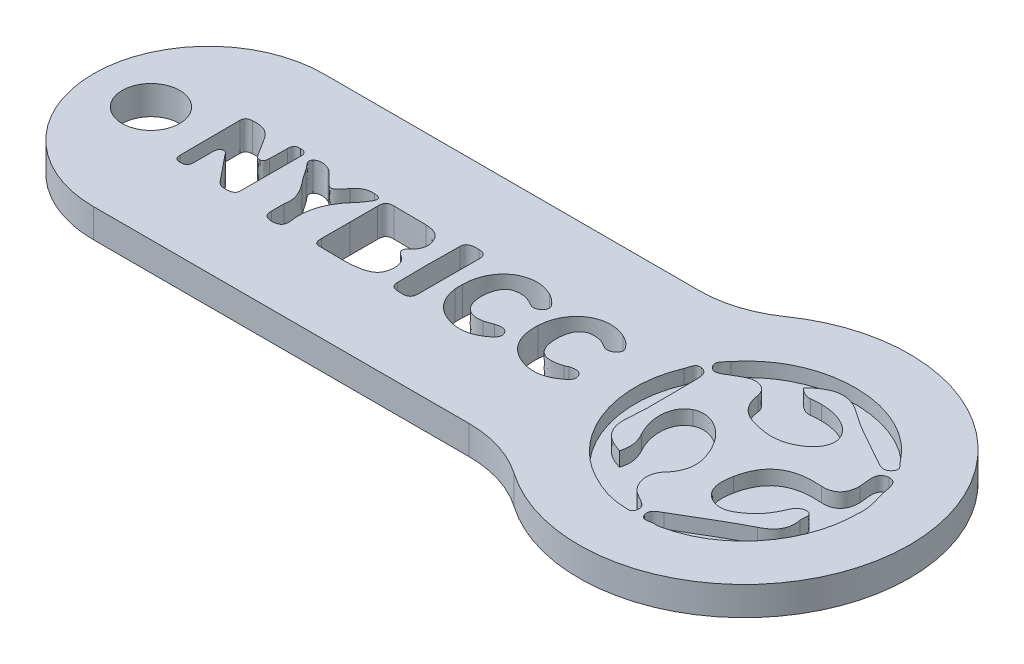
from build123d import *

# Parameters (mm, degrees)
ESQUISSE1_R             = 2
BOSS_EXTRU_1_DEPTH      = 2
ENL_V_MAT_EXTRU_1_DEPTH = 41.002266801
ENL_V_MAT_EXTRU_2_DEPTH = 1
CONG_1_R                = 8


with BuildPart() as part:
    # Esquisse1 → Boss.-Extru.1 (new body)
    with BuildSketch(Plane(origin=(0, 0, 0), x_dir=(1, 0, 0), z_dir=(0, 1, 0))):
        with BuildLine():
            Line((-18.5, 8), (18.5, 8))
            ThreePointArc((18.5, 8), (38.261355821, 0), (18.5, -8))
            Line((18.5, -8), (-18.5, -8))
            Line((-18.5, -8), (-18.5, 8))
        make_face()
        with Locations(Location((-14.5, 0, 0), (0, 0, 270))):
            Circle(ESQUISSE1_R, mode=Mode.SUBTRACT)
    extrude(amount=BOSS_EXTRU_1_DEPTH)

    # Esquisse4 → Enlèv. mat.-Extru.1 (cut, through all)
    with BuildSketch(Plane(origin=(0, 2, 0), x_dir=(1, 0, 0), z_dir=(0, 1, 0))):
        with BuildLine():
            add(Edge.make_bspline(
                [(-6.3332062, -1.619049103), (-6.335767284, -1.888353596), (-6.25457224, -2.225895783), (-6.622652099, -2.312538556)],
                knots=[1, 1, 1, 1, 2, 2, 2, 2], degree=3))
            add(Edge.make_bspline(
                [(-6.622652099, -2.312538556), (-6.978013353, -2.396142756), (-7.346071508, -2.405866193), (-7.617351073, -2.065979963)],
                knots=[2, 2, 2, 2, 3, 3, 3, 3], degree=3))
            add(Edge.make_bspline(
                [(-7.617351073, -2.065979963), (-8.070966795, -1.497592951), (-8.529769798, -0.933373127), (-8.990678099, -0.370976448)],
                knots=[3, 3, 3, 3, 4, 4, 4, 4], degree=3))
            add(Edge.make_bspline(
                [(-8.990678099, -0.370976448), (-9.10683845, -0.22911844), (-9.206699022, -0.003395784), (-9.43962744, -0.104363264)],
                knots=[4, 4, 4, 4, 5, 5, 5, 5], degree=3))
            add(Edge.make_bspline(
                [(-9.43962744, -0.104363264), (-9.635875926, -0.189530159), (-9.657037425, -0.403098518), (-9.657406395, -0.60234217)],
                knots=[5, 5, 5, 5, 6, 6, 6, 6], degree=3))
            add(Edge.make_bspline(
                [(-9.657406395, -0.60234217), (-9.658144334, -1.030520686), (-9.663939329, -1.458612385), (-9.660705418, -1.886704084)],
                knots=[6, 6, 6, 6, 7, 7, 7, 7], degree=3))
            add(Edge.make_bspline(
                [(-9.660705418, -1.886704084), (-9.665849103, -2.219614951), (-9.847620698, -2.329439876), (-10.15591047, -2.322324401)],
                knots=[7, 7, 7, 7, 8, 8, 8, 8], degree=3))
            add(Edge.make_bspline(
                [(-10.15591047, -2.322324401), (-10.450137814, -2.315450477), (-10.589503308, -2.175379299), (-10.582869285, -1.886704084)],
                knots=[8, 8, 8, 8, 9, 9, 9, 9], degree=3))
            add(Edge.make_bspline(
                [(-10.582869285, -1.886704084), (-10.59099202, -0.495407593), (-10.597877528, 0.895873393), (-10.604633139, 2.287220144)],
                knots=[9, 9, 9, 9, 10, 10, 10, 10], degree=3))
            add(Edge.make_bspline(
                [(-10.604633139, 2.287220144), (-10.590666703, 2.573025978), (-10.443715605, 2.692856466), (-10.15310637, 2.706122551)],
                knots=[10, 10, 10, 10, 11, 11, 11, 11], degree=3))
            add(Edge.make_bspline(
                [(-10.15310637, 2.706122551), (-9.500572557, 2.768109465), (-8.976114647, 2.5926101), (-8.626201122, 2.002388762)],
                knots=[11, 11, 11, 11, 12, 12, 12, 12], degree=3))
            add(Edge.make_bspline(
                [(-8.626201122, 2.002388762), (-8.39796079, 1.617444817), (-8.151814574, 1.243135881), (-7.910095995, 0.86630927)],
                knots=[12, 12, 12, 12, 13, 13, 13, 13], degree=3))
            add(Edge.make_bspline(
                [(-7.910095995, 0.86630927), (-7.816790062, 0.720761565), (-7.709875658, 0.563493645), (-7.510458373, 0.602083538)],
                knots=[13, 13, 13, 13, 14, 14, 14, 14], degree=3))
            add(Edge.make_bspline(
                [(-7.510458373, 0.602083538), (-7.299190648, 0.642887248), (-7.277964037, 0.851420256), (-7.267828221, 1.010728362)],
                knots=[14, 14, 14, 14, 15, 15, 15, 15], degree=3))
            add(Edge.make_bspline(
                [(-7.267828221, 1.010728362), (-7.242152269, 1.415943938), (-7.241457738, 1.823373332), (-7.247730223, 2.229717522)],
                knots=[15, 15, 15, 15, 16, 16, 16, 16], degree=3))
            add(Edge.make_bspline(
                [(-7.247730223, 2.229717522), (-7.252678759, 2.549201896), (-7.124689672, 2.704863713), (-6.793702123, 2.701434465)],
                knots=[16, 16, 16, 16, 17, 17, 17, 17], degree=3))
            add(Edge.make_bspline(
                [(-6.793702123, 2.701434465), (-6.473392992, 2.698135441), (-6.323634691, 2.555930168), (-6.326043847, 2.234405607)],
                knots=[17, 17, 17, 17, 18, 18, 18, 18], degree=3))
            add(Edge.make_bspline(
                [(-6.326043847, 2.234405607), (-6.331296239, 1.527937102), (-6.329190941, 0.821468596), (-6.329842064, 0.115021795)],
                knots=[18, 18, 18, 18, 19, 19, 19, 19], degree=3))
            add(Edge.make_bspline(
                [(-6.329842064, 0.115021795), (-6.330384667, -0.463001838), (-6.327845287, -1.041025471), (-6.3332062, -1.619049103)],
                knots=[0, 0, 0, 0, 1, 1, 1, 1], degree=3))
        make_face()
        with BuildLine():
            add(Edge.make_bspline(
                [(-2.655267904, 2.01232924), (-2.346917733, 2.402134904), (-2.0133691, 2.586749992), (-1.5106587, 2.554931779)],
                knots=[6, 6, 6, 6, 7, 7, 7, 7], degree=3))
            add(Edge.make_bspline(
                [(-1.5106587, 2.554931779), (-1.007383993, 2.523070158), (-0.957616488, 2.325258977), (-1.202286825, 1.951557756)],
                knots=[7, 7, 7, 7, 8, 8, 8, 8], degree=3))
            add(Edge.make_bspline(
                [(-1.202286825, 1.951557756), (-1.330861923, 1.755135637), (-1.457939438, 1.553070451), (-1.615815072, 1.381217375)],
                knots=[8, 8, 8, 8, 9, 9, 9, 9], degree=3))
            add(Edge.make_bspline(
                [(-1.615815072, 1.381217375), (-2.498282137, 0.420507024), (-2.974817391, -0.669277619), (-2.774249789, -2.003819416)],
                knots=[9, 9, 9, 9, 10, 10, 10, 10], degree=3))
            add(Edge.make_bspline(
                [(-2.774249789, -2.003819416), (-2.700151986, -2.496676154), (-2.951919564, -2.704514631), (-3.448617928, -2.686630451)],
                knots=[10, 10, 10, 10, 11, 11, 11, 11], degree=3))
            add(Edge.make_bspline(
                [(-3.448617928, -2.686630451), (-3.854679964, -2.672132111), (-4.035149569, -2.48348006), (-4.037450203, -2.094108478)],
                knots=[11, 11, 11, 11, 12, 12, 12, 12], degree=3))
            add(Edge.make_bspline(
                [(-4.037450203, -2.094108478), (-4.038947787, -1.836958283), (-4.037124642, -1.579808088), (-4.036647152, -1.193909162)],
                knots=[12, 12, 12, 12, 13, 13, 13, 13], degree=3))
            add(Edge.make_bspline(
                [(-4.036647152, -1.193909162), (-3.889146078, -0.537490315), (-4.200773568, 0.095119133), (-4.679349007, 0.684602532)],
                knots=[0, 0, 0, 0, 1, 1, 1, 1], degree=3))
            add(Edge.make_bspline(
                [(-4.679349007, 0.684602532), (-4.935023323, 0.999355412), (-5.164023299, 1.337678948), (-5.383929256, 1.678997649)],
                knots=[1, 1, 1, 1, 2, 2, 2, 2], degree=3))
            add(Edge.make_bspline(
                [(-5.383929256, 1.678997649), (-5.535337068, 1.914053068), (-5.92592408, 2.169423527), (-5.662761849, 2.43629716)],
                knots=[2, 2, 2, 2, 3, 3, 3, 3], degree=3))
            add(Edge.make_bspline(
                [(-5.662761849, 2.43629716), (-5.411102791, 2.691624211), (-4.964909871, 2.616441203), (-4.634877303, 2.451793889)],
                knots=[3, 3, 3, 3, 4, 4, 4, 4], degree=3))
            add(Edge.make_bspline(
                [(-4.634877303, 2.451793889), (-4.414059774, 2.341623869), (-4.235435018, 2.13287382), (-4.060521663, 1.946999895)],
                knots=[4, 4, 4, 4, 5, 5, 5, 5], degree=3))
            add(Edge.make_bspline(
                [(-4.060521663, 1.946999895), (-3.340531502, 1.182017131), (-3.325751009, 1.164740666), (-2.655267904, 2.01232924)],
                knots=[5, 5, 5, 5, 6, 6, 6, 6], degree=3))
        make_face()
        with BuildLine():
            add(Edge.make_bspline(
                [(-0.244399098, -2.531923615), (-0.591512794, -2.54364383), (-0.649397633, -2.288143146), (-0.64779153, -2.003819416)],
                knots=[9, 9, 9, 9, 10, 10, 10, 10], degree=3))
            add(Edge.make_bspline(
                [(-0.64779153, -2.003819416), (-0.644145241, -1.340194807), (-0.645273854, -0.67674383), (-0.644492506, -0.013119221)],
                knots=[10, 10, 10, 10, 11, 11, 11, 11], degree=3))
            add(Edge.make_bspline(
                [(-0.644492506, -0.013119221), (-0.643689454, 0.628953215), (-0.629798829, 1.271394621), (-0.646879957, 1.91305468)],
                knots=[0, 0, 0, 0, 1, 1, 1, 1], degree=3))
            add(Edge.make_bspline(
                [(-0.646879957, 1.91305468), (-0.657753712, 2.319181828), (-0.512184303, 2.497936809), (-0.08745674, 2.48534843)],
                knots=[1, 1, 1, 1, 2, 2, 2, 2], degree=3))
            add(Edge.make_bspline(
                [(-0.08745674, 2.48534843), (0.661052611, 2.463253654), (1.411667259, 2.500237443), (2.159503782, 2.468332414)],
                knots=[2, 2, 2, 2, 3, 3, 3, 3], degree=3))
            add(Edge.make_bspline(
                [(2.159503782, 2.468332414), (2.661714988, 2.446845354), (3.143285593, 2.308069328), (3.366664207, 1.778359026)],
                knots=[3, 3, 3, 3, 4, 4, 4, 4], degree=3))
            add(Edge.make_bspline(
                [(3.366664207, 1.778359026), (3.581751853, 1.268139006), (3.484083396, 0.814219426), (3.06135261, 0.446638762)],
                knots=[4, 4, 4, 4, 5, 5, 5, 5], degree=3))
            add(Edge.make_bspline(
                [(3.06135261, 0.446638762), (2.742128684, 0.169021599), (2.809064134, -0.048366682), (3.140442356, -0.254295198)],
                knots=[5, 5, 5, 5, 6, 6, 6, 6], degree=3))
            add(Edge.make_bspline(
                [(3.140442356, -0.254295198), (3.659126975, -0.576557697), (3.719377561, -1.066983576), (3.595512253, -1.604203498)],
                knots=[6, 6, 6, 6, 7, 7, 7, 7], degree=3))
            add(Edge.make_bspline(
                [(3.595512253, -1.604203498), (3.479503831, -2.107304572), (3.097555051, -2.317226642), (2.633912034, -2.426094416)],
                knots=[7, 7, 7, 7, 8, 8, 8, 8], degree=3))
            add(Edge.make_bspline(
                [(2.633912034, -2.426094416), (1.681427537, -2.650080744), (0.715095823, -2.499888361), (-0.244399098, -2.531923615)],
                knots=[8, 8, 8, 8, 9, 9, 9, 9], degree=3))
        make_face()
        with BuildLine():
            add(Edge.make_bspline(
                [(5.47751384, 2.82232631), (5.878735861, 2.832700871), (6.06562988, 2.645915373), (6.061831662, 2.244346086)],
                knots=[5, 5, 5, 5, 6, 6, 6, 6], degree=3))
            add(Edge.make_bspline(
                [(6.061831662, 2.244346086), (6.055059982, 1.540134807), (6.058445822, 0.835836711), (6.057816403, 0.131603728)],
                knots=[6, 6, 6, 6, 7, 7, 7, 7], degree=3))
            add(Edge.make_bspline(
                [(6.057816403, 0.131603728), (6.057273801, -0.551294123), (6.05499487, -1.234278791), (6.056058371, -1.917176642)],
                knots=[0, 0, 0, 0, 1, 1, 1, 1], degree=3))
            add(Edge.make_bspline(
                [(6.056058371, -1.917176642), (6.05668779, -2.29022674), (5.938053171, -2.526020099), (5.502712302, -2.520377033)],
                knots=[1, 1, 1, 1, 2, 2, 2, 2], degree=3))
            add(Edge.make_bspline(
                [(5.502712302, -2.520377033), (5.098690451, -2.515081232), (4.652953318, -2.527235529), (4.640755613, -2.003819416)],
                knots=[2, 2, 2, 2, 3, 3, 3, 3], degree=3))
            add(Edge.make_bspline(
                [(4.640755613, -2.003819416), (4.607005735, -0.554072248), (4.605725193, 0.897563176), (4.643989524, 2.347180119)],
                knots=[3, 3, 3, 3, 4, 4, 4, 4], degree=3))
            add(Edge.make_bspline(
                [(4.643989524, 2.347180119), (4.656925168, 2.83682465), (5.108609226, 2.812733098), (5.47751384, 2.82232631)],
                knots=[4, 4, 4, 4, 5, 5, 5, 5], degree=3))
        make_face()
        with BuildLine():
            add(Edge.make_bspline(
                [(11.059969843, -2.108520002), (10.27202414, -2.707292756), (9.398390644, -2.76250799), (8.511213788, -2.400657209)],
                knots=[11, 11, 11, 11, 12, 12, 12, 12], degree=3))
            add(Edge.make_bspline(
                [(8.511213788, -2.400657209), (7.622192085, -2.038198713), (7.168098872, -1.314063068), (7.034032636, -0.381481233)],
                knots=[12, 12, 12, 12, 13, 13, 13, 13], degree=3))
            add(Edge.make_bspline(
                [(7.034032636, -0.381481233), (7.009854267, -0.213751936), (7.030994062, -0.039598225), (7.031211103, 0.131603728)],
                knots=[13, 13, 13, 13, 14, 14, 14, 14], degree=3))
            add(Edge.make_bspline(
                [(7.031211103, 0.131603728), (7.016951509, 2.218084123), (8.859781659, 3.476618156), (10.627016425, 2.589137443)],
                knots=[0, 0, 0, 0, 1, 1, 1, 1], degree=3))
            add(Edge.make_bspline(
                [(10.627016425, 2.589137443), (10.851870917, 2.476276115), (11.064397479, 2.315318498), (11.240374335, 2.135391496)],
                knots=[1, 1, 1, 1, 2, 2, 2, 2], degree=3))
            add(Edge.make_bspline(
                [(11.240374335, 2.135391496), (11.417306171, 1.954509514), (11.594845721, 1.71181425), (11.361570038, 1.46082802)],
                knots=[2, 2, 2, 2, 3, 3, 3, 3], degree=3))
            add(Edge.make_bspline(
                [(11.361570038, 1.46082802), (11.166493573, 1.250992766), (10.911774237, 1.117946623), (10.617119354, 1.292230559)],
                knots=[3, 3, 3, 3, 4, 4, 4, 4], degree=3))
            add(Edge.make_bspline(
                [(10.617119354, 1.292230559), (10.240075702, 1.51517509), (9.848446894, 1.666148821), (9.400734687, 1.588534953)],
                knots=[4, 4, 4, 4, 5, 5, 5, 5], degree=3))
            add(Edge.make_bspline(
                [(9.400734687, 1.588534953), (9.275892695, 1.566917668), (9.142282245, 1.555544719), (9.031417695, 1.501197649)],
                knots=[5, 5, 5, 5, 6, 6, 6, 6], degree=3))
            add(Edge.make_bspline(
                [(9.031417695, 1.501197649), (8.47518498, 1.22868095), (8.231382807, 0.184561736), (8.518766816, -0.653303401)],
                knots=[6, 6, 6, 6, 7, 7, 7, 7], degree=3))
            add(Edge.make_bspline(
                [(8.518766816, -0.653303401), (8.710110175, -1.210838361), (9.240905683, -1.47805926), (9.923543085, -1.340021174)],
                knots=[7, 7, 7, 7, 8, 8, 8, 8], degree=3))
            add(Edge.make_bspline(
                [(9.923543085, -1.340021174), (10.130339765, -1.298175666), (10.325242597, -1.199899494), (10.528827069, -1.138173029)],
                knots=[8, 8, 8, 8, 9, 9, 9, 9], degree=3))
            add(Edge.make_bspline(
                [(10.528827069, -1.138173029), (10.849440057, -1.041025471), (11.205126874, -0.985549787), (11.398814276, -1.311719025)],
                knots=[9, 9, 9, 9, 10, 10, 10, 10], degree=3))
            add(Edge.make_bspline(
                [(11.398814276, -1.311719025), (11.611427655, -1.669923518), (11.317033221, -1.913269904), (11.059969843, -2.108520002)],
                knots=[10, 10, 10, 10, 11, 11, 11, 11], degree=3))
        make_face()
        with BuildLine():
            add(Edge.make_bspline(
                [(15.6467656, 1.340891155), (15.484766186, 1.438776653), (15.31460603, 1.544866301), (15.134027905, 1.586668401)],
                knots=[10, 10, 10, 10, 11, 11, 11, 11], degree=3))
            add(Edge.make_bspline(
                [(15.134027905, 1.586668401), (14.124700366, 1.820421574), (13.573242554, 1.312545598), (13.56126189, 0.156867302)],
                knots=[11, 11, 11, 11, 12, 12, 12, 12], degree=3))
            add(Edge.make_bspline(
                [(13.56126189, 0.156867302), (13.547544897, -1.149459162), (14.215076245, -1.63363426), (15.450647338, -1.21231424)],
                knots=[0, 0, 0, 0, 1, 1, 1, 1], degree=3))
            add(Edge.make_bspline(
                [(15.450647338, -1.21231424), (15.531126147, -1.184880256), (15.605440991, -1.139475275), (15.686180248, -1.113256721)],
                knots=[1, 1, 1, 1, 2, 2, 2, 2], degree=3))
            add(Edge.make_bspline(
                [(15.686180248, -1.113256721), (16.012089037, -1.007253889), (16.361438256, -0.98476844), (16.542190014, -1.311719025)],
                knots=[2, 2, 2, 2, 3, 3, 3, 3], degree=3))
            add(Edge.make_bspline(
                [(16.542190014, -1.311719025), (16.74351726, -1.67591385), (16.435145385, -1.911620392), (16.178342455, -2.098188849)],
                knots=[3, 3, 3, 3, 4, 4, 4, 4], degree=3))
            add(Edge.make_bspline(
                [(16.178342455, -2.098188849), (15.318165502, -2.723006525), (14.388188159, -2.767282892), (13.462985718, -2.290747638)],
                knots=[4, 4, 4, 4, 5, 5, 5, 5], degree=3))
            add(Edge.make_bspline(
                [(13.462985718, -2.290747638), (12.430738648, -1.759083967), (12.067151538, -0.799328596), (12.119849097, 0.282577459)],
                knots=[5, 5, 5, 5, 6, 6, 6, 6], degree=3))
            add(Edge.make_bspline(
                [(12.119849097, 0.282577459), (12.217517554, 2.284672307), (13.977459741, 3.415673039), (15.694254174, 2.638839836)],
                knots=[6, 6, 6, 6, 7, 7, 7, 7], degree=3))
            add(Edge.make_bspline(
                [(15.694254174, 2.638839836), (15.931176147, 2.531621574), (16.145265405, 2.395450041), (16.322110424, 2.206580949)],
                knots=[7, 7, 7, 7, 8, 8, 8, 8], degree=3))
            add(Edge.make_bspline(
                [(16.322110424, 2.206580949), (16.514669213, 2.001129924), (16.745861303, 1.762645256), (16.509807494, 1.487480656)],
                knots=[8, 8, 8, 8, 9, 9, 9, 9], degree=3))
            add(Edge.make_bspline(
                [(16.509807494, 1.487480656), (16.291898315, 1.23349926), (15.982397826, 1.137957805), (15.6467656, 1.340891155)],
                knots=[9, 9, 9, 9, 10, 10, 10, 10], degree=3))
        make_face()
    extrude(amount=-ENL_V_MAT_EXTRU_1_DEPTH, mode=Mode.SUBTRACT)

    # Esquisse5 → Enlèv. mat.-Extru.2 (cut)
    with BuildSketch(Plane(origin=(0, 2, 0), x_dir=(1, 0, 0), z_dir=(0, 1, 0))):
        with BuildLine():
            add(Edge.make_bspline(
                [(23.186663146, -6.769797032), (19.809617805, -4.933230685), (18.300149632, -0.679304914), (19.787679299, 2.792463637)],
                knots=[9, 9, 9, 9, 10, 10, 10, 10], degree=3))
            add(Edge.make_bspline(
                [(19.787679299, 2.792463637), (19.903969875, 3.063808315), (19.90182551, 3.526413876), (20.358905207, 3.437257768)],
                knots=[10, 10, 10, 10, 11, 11, 11, 11], degree=3))
            add(Edge.make_bspline(
                [(20.358905207, 3.437257768), (20.775736818, 3.356019316), (20.87586218, 3.003106284), (20.870748693, 2.587676757)],
                knots=[11, 11, 11, 11, 12, 12, 12, 12], degree=3))
            add(Edge.make_bspline(
                [(20.870748693, 2.587676757), (20.851779309, 1.040022388), (20.974997834, -0.519467229), (20.824727316, -2.052853322)],
                knots=[12, 12, 12, 12, 13, 13, 13, 13], degree=3))
            add(Edge.make_bspline(
                [(20.824727316, -2.052853322), (20.689962209, -3.427226486), (21.291704084, -4.053216183), (22.495847638, -4.410995275)],
                knots=[13, 13, 13, 13, 14, 14, 14, 14], degree=3))
            add(Edge.make_bspline(
                [(22.495847638, -4.410995275), (22.689500314, -3.765376388), (22.587395539, -3.237532638), (22.270524338, -2.661688097)],
                knots=[0, 0, 0, 0, 1, 1, 1, 1], degree=3))
            add(Edge.make_bspline(
                [(22.270524338, -2.661688097), (21.485191808, -1.2333759), (21.653277053, 0.156172771), (22.576508761, 0.620386606)],
                knots=[1, 1, 1, 1, 2, 2, 2, 2], degree=3))
            add(Edge.make_bspline(
                [(22.576508761, 0.620386606), (23.507658126, 1.088518032), (24.876752853, 0.314154756), (25.561795069, -1.087229162)],
                knots=[2, 2, 2, 2, 3, 3, 3, 3], degree=3))
            add(Edge.make_bspline(
                [(25.561795069, -1.087229162), (26.074133409, -2.134999006), (26.251950772, -3.132623693), (25.35082252, -4.130743234)],
                knots=[3, 3, 3, 3, 4, 4, 4, 4], degree=3))
            add(Edge.make_bspline(
                [(25.35082252, -4.130743234), (24.736379405, -4.811166818), (24.985950528, -5.909246768), (25.740107286, -6.388759825)],
                knots=[4, 4, 4, 4, 5, 5, 5, 5], degree=3))
            add(Edge.make_bspline(
                [(25.740107286, -6.388759825), (25.911656505, -6.49779255), (26.091783184, -6.593464229), (26.267951036, -6.695239102)],
                knots=[5, 5, 5, 5, 6, 6, 6, 6], degree=3))
            add(Edge.make_bspline(
                [(26.267951036, -6.695239102), (26.529893497, -6.846664278), (26.743505264, -7.040811807), (26.661194629, -7.375167833)],
                knots=[6, 6, 6, 6, 7, 7, 7, 7], degree=3))
            add(Edge.make_bspline(
                [(26.661194629, -7.375167833), (26.55991461, -7.786391104), (26.214012003, -7.63529583), (25.956688175, -7.628862735)],
                knots=[7, 7, 7, 7, 8, 8, 8, 8], degree=3))
            add(Edge.make_bspline(
                [(25.956688175, -7.628862735), (24.954939708, -7.603295303), (24.048368068, -7.23825836), (23.186663146, -6.769797032)],
                knots=[8, 8, 8, 8, 9, 9, 9, 9], degree=3))
        make_face()
        with BuildLine():
            add(Edge.make_bspline(
                [(29.456952041, 3.520475634), (29.409446103, 2.504623842), (27.919937022, 1.549803984), (26.503501309, 1.757642461)],
                knots=[3, 3, 3, 3, 4, 4, 4, 4], degree=3))
            add(Edge.make_bspline(
                [(26.503501309, 1.757642461), (25.335811964, 1.929109204), (24.195669464, 2.169525537), (23.97545965, 3.74307724)],
                knots=[4, 4, 4, 4, 5, 5, 5, 5], degree=3))
            add(Edge.make_bspline(
                [(23.97545965, 3.74307724), (23.890674747, 4.347953188), (23.203983019, 4.748619584), (22.453125285, 4.37294329)],
                knots=[5, 5, 5, 5, 6, 6, 6, 6], degree=3))
            add(Edge.make_bspline(
                [(22.453125285, 4.37294329), (22.198935529, 4.245848412), (21.95414799, 4.098959394), (21.711174914, 3.950998192)],
                knots=[6, 6, 6, 6, 7, 7, 7, 7], degree=3))
            add(Edge.make_bspline(
                [(21.711174914, 3.950998192), (21.36015882, 3.737303949), (20.97582259, 3.449629106), (20.651198684, 3.911574862)],
                knots=[7, 7, 7, 7, 8, 8, 8, 8], degree=3))
            add(Edge.make_bspline(
                [(20.651198684, 3.911574862), (20.37061674, 4.311086601), (20.809056955, 4.578389975), (21.005183898, 4.828868329)],
                knots=[8, 8, 8, 8, 9, 9, 9, 9], degree=3))
            add(Edge.make_bspline(
                [(21.005183898, 4.828868329), (23.928283614, 8.56352781), (30.092343955, 8.488392552), (32.918122479, 4.687917553)],
                knots=[9, 9, 9, 9, 10, 10, 10, 10], degree=3))
            add(Edge.make_bspline(
                [(32.918122479, 4.687917553), (33.085218016, 4.463171581), (33.509967284, 4.24906496), (33.194745595, 3.874873227)],
                knots=[10, 10, 10, 10, 11, 11, 11, 11], degree=3))
            add(Edge.make_bspline(
                [(33.194745595, 3.874873227), (32.899647948, 3.524434462), (32.5761787, 3.664642958), (32.22565746, 3.874130946)],
                knots=[11, 11, 11, 11, 12, 12, 12, 12], degree=3))
            add(Edge.make_bspline(
                [(32.22565746, 3.874130946), (30.969719238, 4.624658778), (29.615800019, 5.237122479), (28.44893543, 6.103610985)],
                knots=[12, 12, 12, 12, 13, 13, 13, 13], degree=3))
            add(Edge.make_bspline(
                [(28.44893543, 6.103610985), (27.188048672, 7.040038787), (26.193393106, 6.833107542), (25.100591593, 5.772636459)],
                knots=[13, 13, 13, 13, 14, 14, 14, 14], degree=3))
            add(Edge.make_bspline(
                [(25.100591593, 5.772636459), (25.3971738, 5.479930604), (25.666374112, 5.331886927), (26.013596329, 5.360258529)],
                knots=[0, 0, 0, 0, 1, 1, 1, 1], degree=3))
            add(Edge.make_bspline(
                [(26.013596329, 5.360258529), (26.256899307, 5.380217621), (26.50086209, 5.404218016), (26.744494971, 5.402403553)],
                knots=[1, 1, 1, 1, 2, 2, 2, 2], degree=3))
            add(Edge.make_bspline(
                [(26.744494971, 5.402403553), (28.303283545, 5.391021923), (29.505447685, 4.55381225), (29.456952041, 3.520475634)],
                knots=[2, 2, 2, 2, 3, 3, 3, 3], degree=3))
        make_face()
        with BuildLine():
            add(Edge.make_bspline(
                [(28.008680752, -2.001388557), (28.386418936, -0.107419202), (29.587098515, 0.635397163), (31.650307773, 0.477786318)],
                knots=[11, 11, 11, 11, 12, 12, 12, 12], degree=3))
            add(Edge.make_bspline(
                [(31.650307773, 0.477786318), (32.417990526, 0.419063701), (33.010660087, 0.836142739), (32.989876239, 1.811746445)],
                knots=[12, 12, 12, 12, 13, 13, 13, 13], degree=3))
            add(Edge.make_bspline(
                [(32.989876239, 1.811746445), (32.978164706, 2.360538994), (32.650406728, 3.276925229), (33.476812098, 3.344967587)],
                knots=[13, 13, 13, 13, 14, 14, 14, 14], degree=3))
            add(Edge.make_bspline(
                [(33.476812098, 3.344967587), (34.182473212, 3.403277826), (34.110719452, 2.450684809), (34.290846131, 1.919624511)],
                knots=[14, 14, 14, 14, 15, 15, 15, 15], degree=3))
            add(Edge.make_bspline(
                [(34.290846131, 1.919624511), (34.511550799, 1.269222041), (34.657202684, 0.583272593), (34.572252831, 0.043016267)],
                knots=[15, 15, 15, 15, 16, 16, 16, 16], degree=3))
            add(Edge.make_bspline(
                [(34.572252831, 0.043016267), (34.557242274, -3.684715265), (31.980540019, -6.861509883), (28.528111992, -7.568985459)],
                knots=[0, 0, 0, 0, 1, 1, 1, 1], degree=3))
            add(Edge.make_bspline(
                [(28.528111992, -7.568985459), (28.409347149, -7.593233282), (28.279365625, -7.630677198), (28.166703975, -7.606264424)],
                knots=[1, 1, 1, 1, 2, 2, 2, 2], degree=3))
            add(Edge.make_bspline(
                [(28.166703975, -7.606264424), (27.847688408, -7.537479786), (27.395062393, -7.903011582), (27.221038907, -7.385394805)],
                knots=[2, 2, 2, 2, 3, 3, 3, 3], degree=3))
            add(Edge.make_bspline(
                [(27.221038907, -7.385394805), (27.065984805, -6.923366573), (27.456754131, -6.765673253), (27.778408916, -6.581257842)],
                knots=[3, 3, 3, 3, 4, 4, 4, 4], degree=3))
            add(Edge.make_bspline(
                [(27.778408916, -6.581257842), (29.151792373, -5.793780948), (30.49004123, -4.937849317), (31.901363456, -4.226579865)],
                knots=[4, 4, 4, 4, 5, 5, 5, 5], degree=3))
            add(Edge.make_bspline(
                [(31.901363456, -4.226579865), (32.758779647, -3.794737697), (33.131239393, -3.238522345), (32.960349979, -2.315290637)],
                knots=[5, 5, 5, 5, 6, 6, 6, 6], degree=3))
            add(Edge.make_bspline(
                [(32.960349979, -2.315290637), (32.90839036, -2.033883937), (33.154827411, -1.581257922), (32.667231747, -1.528308596)],
                knots=[6, 6, 6, 6, 7, 7, 7, 7], degree=3))
            add(Edge.make_bspline(
                [(32.667231747, -1.528308596), (32.350195595, -1.493998752), (32.043386415, -1.733177951), (31.914889452, -2.047739836)],
                knots=[7, 7, 7, 7, 8, 8, 8, 8], degree=3))
            add(Edge.make_bspline(
                [(31.914889452, -2.047739836), (31.664328622, -2.660368488), (31.338550058, -3.217903449), (30.828521035, -3.640178449)],
                knots=[8, 8, 8, 8, 9, 9, 9, 9], degree=3))
            add(Edge.make_bspline(
                [(30.828521035, -3.640178449), (30.215067627, -4.148228058), (29.523757265, -4.58204964), (28.723249229, -4.145918742)],
                knots=[9, 9, 9, 9, 10, 10, 10, 10], degree=3))
            add(Edge.make_bspline(
                [(28.723249229, -4.145918742), (27.87045167, -3.681416242), (27.841750166, -2.838515754), (28.008680752, -2.001388557)],
                knots=[10, 10, 10, 10, 11, 11, 11, 11], degree=3))
        make_face()
    extrude(amount=-ENL_V_MAT_EXTRU_2_DEPTH, mode=Mode.SUBTRACT)

    # Congé1
    cong_1_edges = [part.edges().sort_by_distance(p)[0] for p in [
        (18.5, 1, -8),
        (-18.5, 1, -8),
        (18.5, 1, 8),
        (-18.5, 1, 8),
    ]]
    fillet(cong_1_edges, radius=CONG_1_R - 0.0001)  # a hair under: the kernel refuses the full size


solid = part.part
